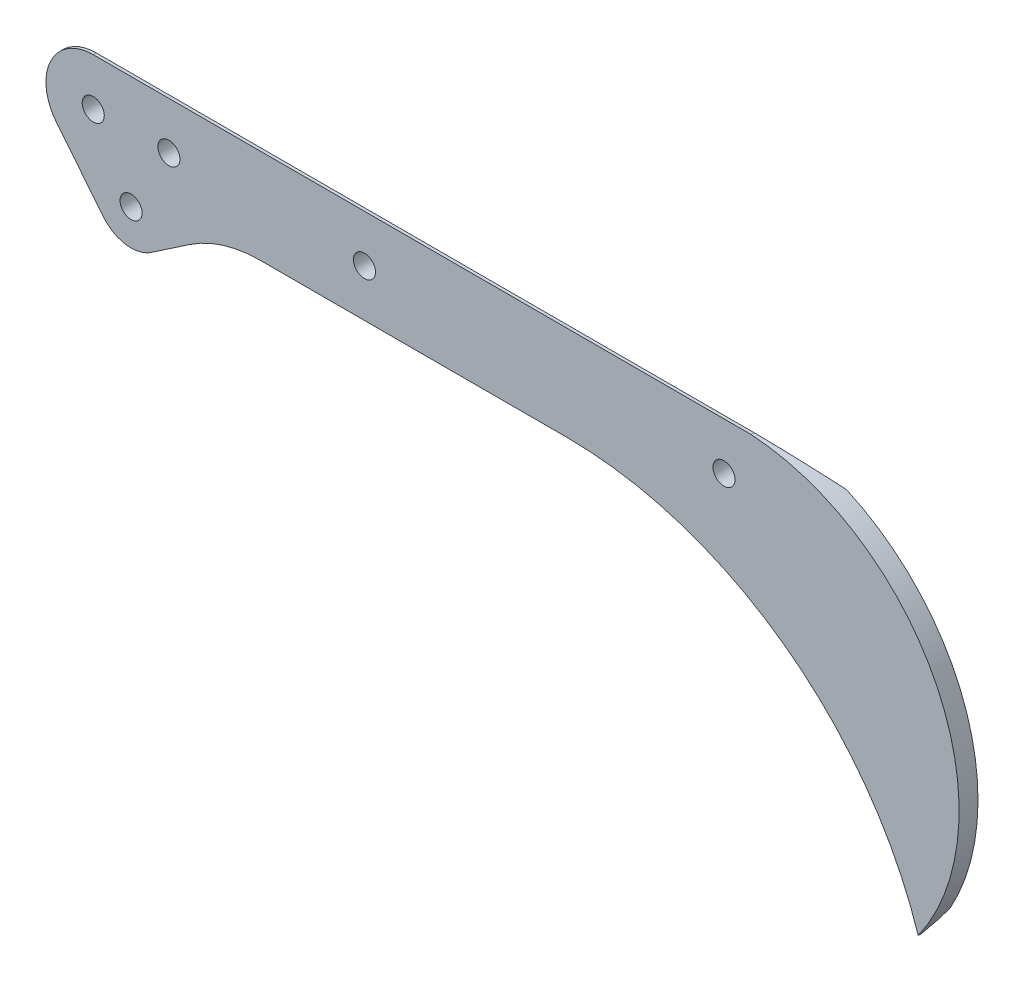
from build123d import *

# Parameters (mm, degrees)
IZIM1_R                     = 1.75
Y_KSEKLIK_EKSTR_ZYON1_DEPTH = 3
Y_KSEKLIK_EKSTR_ZYON2_DEPTH = 3
IZIM4_R                     = 1.75
Y_KSEKLIK_EKSTR_ZYON3_DEPTH = 3
RADYUS1_R                   = 20
IZIM4_3_R                   = 1.75
KES_EKSTR_ZYON1_DEPTH       = 10


with BuildPart() as part:
    # Çizim1 → Yükseklik-Ekstrüzyon1 (new body)
    with BuildSketch(Plane.XY):
        with BuildLine():
            Line((-43, 7.5), (57, 7.5))
            ThreePointArc((57, 7.5), (64.5, 0), (57, -7.5))
            Line((57, -7.5), (-43, -7.5))
            ThreePointArc((-43, -7.5), (-50.5, 0), (-43, 7.5))
        make_face()
        Circle(IZIM1_R, mode=Mode.SUBTRACT)
        with Locations((-43, 0)):
            Circle(IZIM1_R, mode=Mode.SUBTRACT)
        with Locations((57, 0)):
            Circle(IZIM1_R, mode=Mode.SUBTRACT)
    extrude(amount=Y_KSEKLIK_EKSTR_ZYON1_DEPTH)

    # Çizim2 → Yükseklik-Ekstrüzyon2 (add)
    with BuildSketch(Plane(origin=(0, 0, 0), x_dir=(-1, 0, 0), z_dir=(0, 0, -1))):
        with BuildLine():
            ThreePointArc((-57, -7.5), (-64.5, 0), (-57, 7.5))
            Line((-57, 7.5), (-61.290238096, 7.5))
            ThreePointArc((-61.290238096, 7.5), (-90.835057362, -12.499091059), (-87.794753659, -48.04647552))
            ThreePointArc((-87.794753659, -48.04647552), (-66.485762327, -18.707163802), (-32, -7.5))
            Line((-32, -7.5), (-57, -7.5))
        make_face()
    extrude(amount=-Y_KSEKLIK_EKSTR_ZYON2_DEPTH)

    # Çizim4 → Yükseklik-Ekstrüzyon3 (add)
    with BuildSketch(Plane.XY):
        with BuildLine():
            Line((-33.824470976, -15.071432033), (-22.668001232, -7.5))
            Line((-22.668001232, -7.5), (-22.668001232, 7.5))
            Line((-22.668001232, 7.5), (-43, 7.5))
            ThreePointArc((-43, 7.5), (-49.765006227, 3.23800722), (-48.841370401, -4.704082465))
            Line((-48.841370401, -4.704082465), (-41.404337559, -13.93913815))
            ThreePointArc((-41.404337559, -13.93913815), (-37.835472898, -15.985175384), (-33.824470976, -15.071432033))
        make_face()
        with Locations((-37, -10.392304845)):
            Circle(IZIM4_R, mode=Mode.SUBTRACT)
        with Locations((-43, 0)):
            Circle(IZIM4_R, mode=Mode.SUBTRACT)
        with Locations((-31, 0)):
            Circle(IZIM4_R, mode=Mode.SUBTRACT)
    extrude(amount=Y_KSEKLIK_EKSTR_ZYON3_DEPTH)

    # Radyus1
    radyus1_edges = [part.edges().sort_by_distance(p)[0] for p in [
        (-22.668001232, -7.5, 1.5),
    ]]
    fillet(radyus1_edges, radius=RADYUS1_R)

    # Çizim4<3> → Kes-Ekstrüzyon1 (cut)
    with BuildSketch(Plane.XY):
        with Locations((-31, 0)):
            Circle(IZIM4_3_R)
    extrude(amount=KES_EKSTR_ZYON1_DEPTH, mode=Mode.SUBTRACT)

    # Pah2
    # the kernel refuses this chamfer: 3, 2.517298894 mm, written as the material it takes off along each edge
    with BuildSketch(Plane(origin=(32, -66.161957074, 0), x_dir=(0.9999969206836817, -0.0024816573402179206, 0), z_dir=(-0.0024816573402179206, -0.9999969206836817, 0))) as pah2_piece_1:
        with BuildLine():
            Line((61.753882408, -0.077134513), (58.570031741, 2.594433407))
            Line((58.570031741, 2.594433407), (58.510031741, 2.594433407))
            ThreePointArc((58.510031741, 2.594433407), (58.601957074, 1.297216703), (58.601957074, 0))
            Line((58.601957074, 0), (58.661957074, -0.06))
            ThreePointArc((58.661957074, -0.06), (60.207919741, -0.06), (61.753882408, -0.137134513))
            Line((61.753882408, -0.137134513), (61.753882408, -0.077134513))
        make_face()
    revolve(axis=Axis((32, -66.161957074, 0), (0, 0, 1)), revolution_arc=90.142188638, mode=Mode.SUBTRACT)
    with BuildSketch(Plane(origin=(-43, 7.5, 0), x_dir=(0, -0.9996889667359941, -0.024939322090234348), z_dir=(1, 0, 0))) as pah2_piece_2:
        with BuildLine():
            Line((3.092887324, 0), (-0.156600152, -2.591333896))
            Line((-0.156600152, -2.591333896), (-0.21658149, -2.589837537))
            ThreePointArc((-0.21658149, -2.589837537), (-0.092333043, -1.295316866), (-0.059981338, 0.001496359))
            Line((-0.059981338, 0.001496359), (0.001496359, 0.059981338))
            ThreePointArc((0.001496359, 0.059981338), (1.54697818, 0.021426077), (3.094383683, 0.059981338))
            Line((3.094383683, 0.059981338), (3.092887324, 0))
        make_face()
    extrude(amount=122.84756204, mode=Mode.SUBTRACT)
    with BuildSketch(Plane(origin=(-48.841370401, -4.704082465, 0), x_dir=(0.7786071387098311, 0.6270159118904154, -0.024939322090234337), z_dir=(0.6272109953735269, -0.7788493867767694, 0))) as pah2_piece_3:
        with BuildLine():
            Line((3.092887324, 0), (-0.156600152, 2.591333896))
            Line((-0.156600152, 2.591333896), (-0.21658149, 2.589837537))
            ThreePointArc((-0.21658149, 2.589837537), (-0.092333043, 1.295316866), (-0.059981338, -0.001496359))
            Line((-0.059981338, -0.001496359), (0.001496359, -0.059981338))
            ThreePointArc((0.001496359, -0.059981338), (1.54697818, -0.021426077), (3.094383683, -0.059981338))
            Line((3.094383683, -0.059981338), (3.092887324, 0))
        make_face()
    extrude(amount=11.857306228, mode=Mode.SUBTRACT)
    with BuildSketch(Plane(origin=(-37, -10.392304845, 0), x_dir=(-0.7788493867767683, -0.6272109953735282, 0), z_dir=(-0.6272109953735282, 0.7788493867767683, 0))) as pah2_piece_4:
        with BuildLine():
            Line((2.563003121, -0.077134513), (5.746853788, 2.594433407))
            Line((5.746853788, 2.594433407), (5.806853788, 2.594433407))
            ThreePointArc((5.806853788, 2.594433407), (5.714928454, 1.297216703), (5.714928454, 0))
            Line((5.714928454, 0), (5.654928454, -0.06))
            ThreePointArc((5.654928454, -0.06), (4.108965788, -0.06), (2.563003121, -0.137134513))
            Line((2.563003121, -0.137134513), (2.563003121, -0.077134513))
        make_face()
    revolve(axis=Axis((-37, -10.392304845, 0), (0, 0, 1)), revolution_arc=85.318453593, mode=Mode.SUBTRACT)
    with BuildSketch(Plane(origin=(-33.824470976, -15.071432033, 0), x_dir=(-0.5613760376690521, 0.8271849699702446, -0.024939322090234337), z_dir=(0.8274423320595619, 0.5615506986157474, 0))) as pah2_piece_5:
        with BuildLine():
            Line((3.092887324, 0), (-0.156600152, 2.591333896))
            Line((-0.156600152, 2.591333896), (-0.21658149, 2.589837537))
            ThreePointArc((-0.21658149, 2.589837537), (-0.092333043, 1.295316866), (-0.059981338, -0.001496359))
            Line((-0.059981338, -0.001496359), (0.001496359, -0.059981338))
            ThreePointArc((0.001496359, -0.059981338), (1.54697818, -0.021426077), (3.094383683, -0.059981338))
            Line((3.094383683, -0.059981338), (3.092887324, 0))
        make_face()
    extrude(amount=7.337322676, mode=Mode.SUBTRACT)
    with BuildSketch(Plane(origin=(-43, 0, 0), x_dir=(-0.7788493867767701, -0.6272109953735259, 0), z_dir=(0.6272109953735259, -0.7788493867767701, 0))) as pah2_piece_6:
        with BuildLine():
            Line((4.408074667, 0.077134513), (7.591925333, -2.594433407))
            Line((7.591925333, -2.594433407), (7.651925333, -2.594433407))
            ThreePointArc((7.651925333, -2.594433407), (7.56, -1.297216703), (7.56, 0))
            Line((7.56, 0), (7.5, 0.06))
            ThreePointArc((7.5, 0.06), (5.954037333, 0.06), (4.408074667, 0.137134513))
            Line((4.408074667, 0.137134513), (4.408074667, 0.077134513))
        make_face()
    revolve(axis=Axis((-43, 0, 0), (0, 0, -1)), revolution_arc=128.844653269, mode=Mode.SUBTRACT)
    with BuildSketch(Plane(origin=(32, -7.5, 0), x_dir=(0, -0.035409536913662706, 0.9993728857116145), z_dir=(-1, 0, 0))) as pah2_piece_7:
        with BuildLine():
            Line((2.596061434, 0), (-0.186569785, 3.087255045))
            Line((-0.186569785, 3.087255045), (-0.246532158, 3.085130473))
            ThreePointArc((-0.246532158, 3.085130473), (-0.114704195, 1.542868599), (-0.059962373, -0.002124572))
            Line((-0.059962373, -0.002124572), (0.002124572, -0.059962373))
            ThreePointArc((0.002124572, -0.059962373), (1.298527772, -0.01402853), (2.598186006, -0.059962373))
            Line((2.598186006, -0.059962373), (2.596061434, 0))
        make_face()
    extrude(amount=48.522245618, mode=Mode.SUBTRACT)
    with BuildSketch(Plane(origin=(-16.522245618, -27.5, 0), x_dir=(0, 1, 0), z_dir=(1, 0, 0))) as pah2_piece_8:
        with BuildLine():
            Line((23.091925333, -0.077134513), (19.908074667, 2.594433407))
            Line((19.908074667, 2.594433407), (19.848074667, 2.594433407))
            ThreePointArc((19.848074667, 2.594433407), (19.94, 1.297216703), (19.94, 0))
            Line((19.94, 0), (20, -0.06))
            ThreePointArc((20, -0.06), (21.545962667, -0.06), (23.091925333, -0.137134513))
            Line((23.091925333, -0.137134513), (23.091925333, -0.077134513))
        make_face()
    revolve(axis=Axis((-16.522245618, -27.5, 0), (0, 0, 1)), revolution_arc=34.163106862, mode=Mode.SUBTRACT)


solid = part.part
